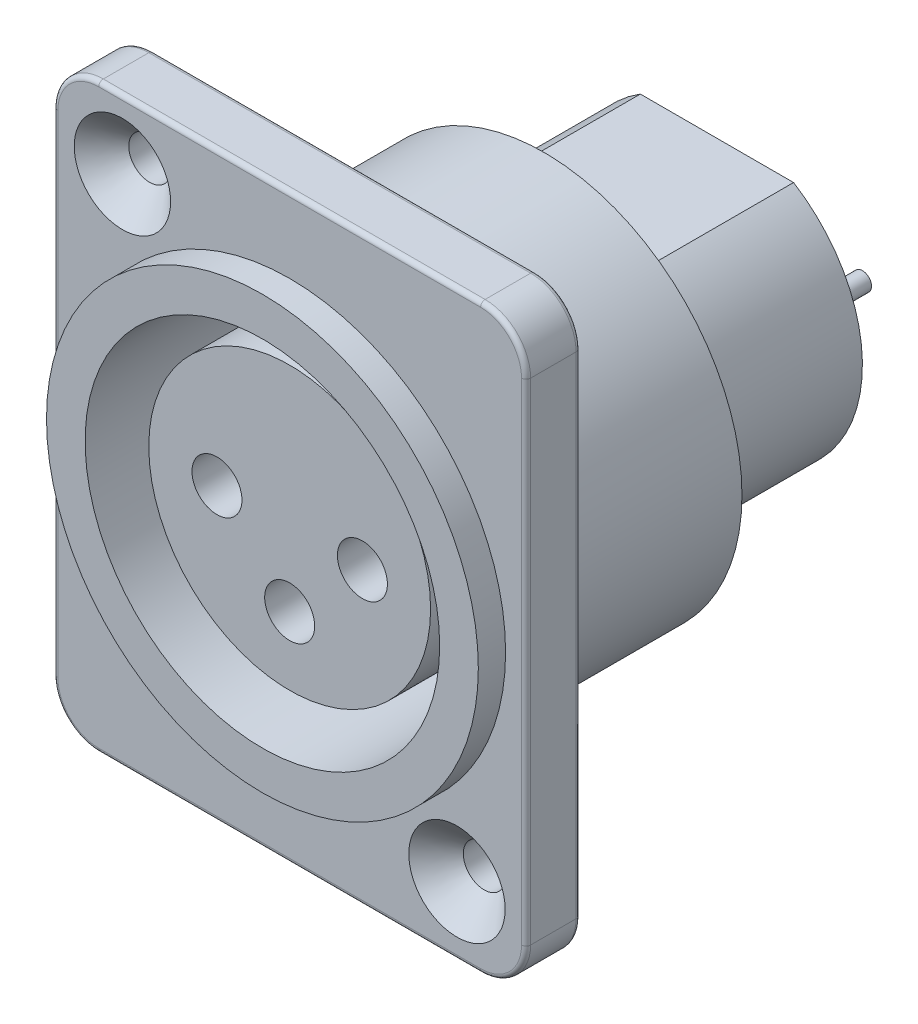
from build123d import *

# Parameters (mm, degrees)
SALIENTE_EXTRUIR1_DEPTH = 9.5
CROQUIS2_R              = 10.875
SALIENTE_EXTRUIR2_DEPTH = 11
CROQUIS3_W              = 26
CROQUIS3_H              = 32
SALIENTE_EXTRUIR3_DEPTH = 3
REDONDEO1_R             = 2.5
CROQUIS4_R              = 11.875
CROQUIS4_R_2            = 9.75
SALIENTE_EXTRUIR4_DEPTH = 1.5
CORTAR_EXTRUIR1_START   = -10
CROQUIS4_3_R            = 9.75
CROQUIS4_3_R_2          = 7.75
CROQUIS4_3_R_3          = 1.375
CORTAR_EXTRUIR1_DEPTH   = 10
CORTAR_EXTRUIR2_REACH   = 33.261
CROQUIS5_R              = 1.15
CHAFL_N1_SIZE           = 1.5
SALIENTE_EXTRUIR5_START = 1
CROQUIS6_R              = 1.375
SALIENTE_EXTRUIR5_DEPTH = 1
CROQUIS6_3_R            = 0.5
SALIENTE_EXTRUIR6_DEPTH = 4
REDONDEO2_R             = 0.25


with BuildPart() as part:
    # Croquis1 → Saliente-Extruir1 (new body)
    with BuildSketch(Plane.XY):
        with BuildLine():
            Line((-4.214261501, 6.8), (4.214261501, 6.8))
            ThreePointArc((4.214261501, 6.8), (0, -8), (-4.214261501, 6.8))
        make_face()
    extrude(amount=SALIENTE_EXTRUIR1_DEPTH)

    # Croquis2 → Saliente-Extruir2 (add)
    with BuildSketch(Plane.XY.offset(9.5)):
        Circle(CROQUIS2_R)
    extrude(amount=SALIENTE_EXTRUIR2_DEPTH)

    # Croquis3 → Saliente-Extruir3 (add)
    with BuildSketch(Plane.XY.offset(20.5)):
        Rectangle(CROQUIS3_W, CROQUIS3_H)
    extrude(amount=SALIENTE_EXTRUIR3_DEPTH)

    # Redondeo1
    redondeo1_edges = [part.edges().sort_by_distance(p)[0] for p in [
        (13, -16, 22),
        (-13, -16, 22),
        (-13, 16, 22),
        (13, 16, 22),
    ]]
    fillet(redondeo1_edges, radius=REDONDEO1_R)

    # Croquis4 → Saliente-Extruir4 (add)
    with BuildSketch(Plane.XY.offset(23.5)):
        Circle(CROQUIS4_R)
        Circle(CROQUIS4_R_2, mode=Mode.SUBTRACT)
    extrude(amount=SALIENTE_EXTRUIR4_DEPTH)

    # Croquis4<3> → Cortar-Extruir1 (cut)
    # profile 1 of 4: a face of its own
    with BuildSketch(Plane.XY.offset(23.5).offset(CORTAR_EXTRUIR1_START)):
        Circle(CROQUIS4_3_R)
        Circle(CROQUIS4_3_R_2, mode=Mode.SUBTRACT)
    # profile 2 of 4: a face of its own
    with BuildSketch(Plane.XY.offset(23.5).offset(CORTAR_EXTRUIR1_START)):
        with Locations((-4, 0)):
            Circle(CROQUIS4_3_R_3)
    # profile 3 of 4: a face of its own
    with BuildSketch(Plane.XY.offset(23.5).offset(CORTAR_EXTRUIR1_START)):
        with Locations((0, -4)):
            Circle(CROQUIS4_3_R_3)
    # profile 4 of 4: a face of its own
    with BuildSketch(Plane.XY.offset(23.5).offset(CORTAR_EXTRUIR1_START)):
        with Locations((4, 0)):
            Circle(CROQUIS4_3_R_3)
    extrude(amount=CORTAR_EXTRUIR1_DEPTH, mode=Mode.SUBTRACT)

    # Croquis5 → Cortar-Extruir2 (cut, up to next)
    with BuildSketch(Plane.XY.offset(23.5), mode=Mode.PRIVATE) as cortar_extruir2_sk1:
        with Locations((-9.2, 12.25)):
            Circle(CROQUIS5_R)
    cortar_extruir2_tool1 = extrude(cortar_extruir2_sk1.sketch, amount=-CORTAR_EXTRUIR2_REACH, mode=Mode.PRIVATE) & part.part
    # Croquis5 → Cortar-Extruir2 (cut, up to next)
    with BuildSketch(Plane.XY.offset(23.5), mode=Mode.PRIVATE) as cortar_extruir2_sk2:
        with Locations((9.2, -12.25)):
            Circle(CROQUIS5_R)
    cortar_extruir2_tool2 = extrude(cortar_extruir2_sk2.sketch, amount=-CORTAR_EXTRUIR2_REACH, mode=Mode.PRIVATE) & part.part
    add(cortar_extruir2_tool1.solids().sort_by_distance((-9.2, 12.25, 23.5))[0], mode=Mode.SUBTRACT)
    add(cortar_extruir2_tool2.solids().sort_by_distance((9.2, -12.25, 23.5))[0], mode=Mode.SUBTRACT)

    # Chaflán1
    chafl_n1_edges = [part.edges().sort_by_distance(p)[0] for p in [
        (8.05, -12.25, 23.5),
        (-10.35, 12.25, 23.5),
    ]]
    chamfer(chafl_n1_edges, length=CHAFL_N1_SIZE)

    # Croquis6 → Saliente-Extruir5 (add)
    with BuildSketch(Plane(origin=(0, 0, 0), x_dir=(-1, 0, 0), z_dir=(0, 0, -1)).offset(SALIENTE_EXTRUIR5_START)):
        with Locations((-4, 0)):
            Circle(CROQUIS6_R)
        with Locations((4, 0)):
            Circle(CROQUIS6_R)
        with Locations((0, -4)):
            Circle(CROQUIS6_R)
    extrude(amount=-SALIENTE_EXTRUIR5_DEPTH)

    # Croquis6<3> → Saliente-Extruir6 (add)
    with BuildSketch(Plane(origin=(0, 0, 0), x_dir=(-1, 0, 0), z_dir=(0, 0, -1))):
        with Locations((-4, 0)):
            Circle(CROQUIS6_3_R)
        with Locations((0, -4)):
            Circle(CROQUIS6_3_R)
        with Locations((4, 0)):
            Circle(CROQUIS6_3_R)
    extrude(amount=SALIENTE_EXTRUIR6_DEPTH)

    # Redondeo2
    redondeo2_edges = [part.edges().sort_by_distance(p)[0] for p in [
        (12.267766953, 15.267766953, 20.5),
        (13, 0, 20.5),
        (12.267766953, -15.267766953, 20.5),
        (0, -16, 20.5),
        (-12.267766953, -15.267766953, 20.5),
        (-13, 0, 20.5),
        (-12.267766953, 15.267766953, 20.5),
        (12.267766953, 15.267766953, 23.5),
        (13, 0, 23.5),
        (12.267766953, -15.267766953, 23.5),
        (0, -16, 23.5),
        (-12.267766953, -15.267766953, 23.5),
        (-13, 0, 23.5),
        (-12.267766953, 15.267766953, 23.5),
        (0, 16, 20.5),
        (0, 16, 23.5),
    ]]
    fillet(redondeo2_edges, radius=REDONDEO2_R)


solid = part.part
